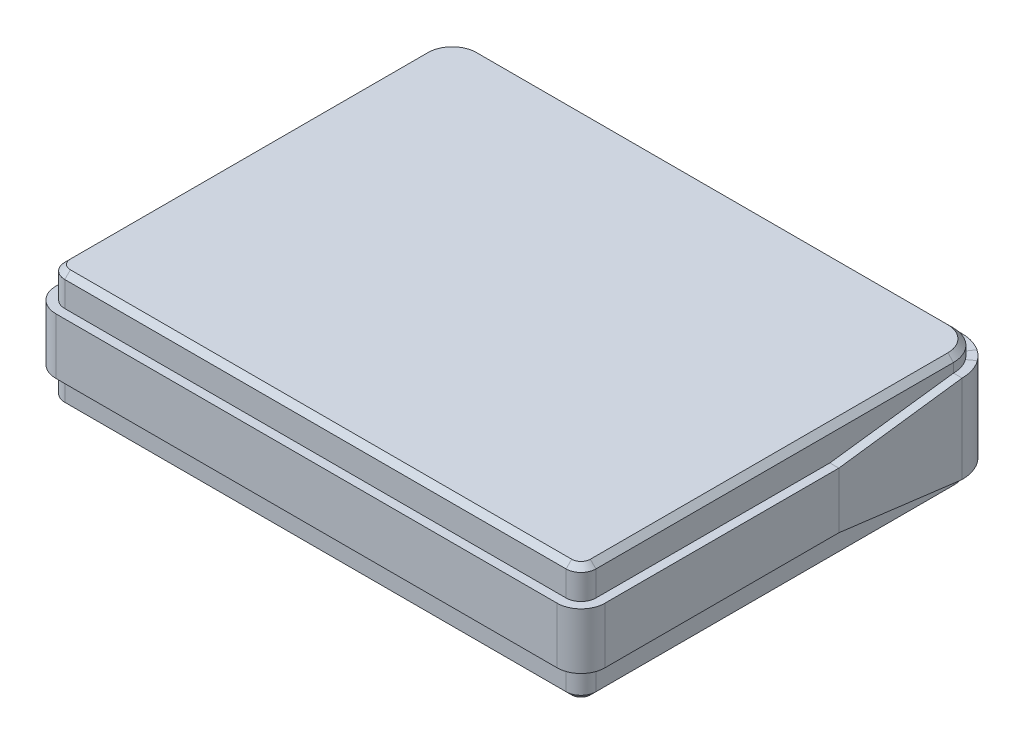
from build123d import *

# Parameters (mm, degrees)
SKETCH2_W           = 142.3
SKETCH2_H           = 107.8
BOSS_EXTRUDE1_DEPTH = 31.5
FILLET1_R           = 4
FILLET2_R           = 8
CHAMFER1_SIZE       = 1.5
SKETCH3_W           = 2.4
SKETCH3_H           = 15
SKETCH5_W           = 2.3
SKETCH5_H           = 23.55
SKETCH8_W           = 2.3
SKETCH8_H           = 23.55
SKETCH10_W          = 2.3
SKETCH10_H          = 3
SKETCH13_W          = 2.3
SKETCH13_H          = 3
BOSS_EXTRUDE2_DEPTH = 126.3
SKETCH16_W          = 2.3
SKETCH16_H          = 23.55
SKETCH17_W          = 135.171862784
SKETCH17_H          = 20.55
CUT_EXTRUDE1_DEPTH  = 1.342484496
CUT_EXTRUDE2_DEPTH  = 3.76
CUT_EXTRUDE3_START  = 1.5
CUT_EXTRUDE3_DEPTH  = 2.26
CUT_EXTRUDE4_START  = 1.5
CUT_EXTRUDE4_DEPTH  = 2.26
CUT_EXTRUDE5_START  = 1.5
CUT_EXTRUDE5_DEPTH  = 2.26
CUT_EXTRUDE6_START  = 1.5
CUT_EXTRUDE6_DEPTH  = 2.26
SKETCH23_R          = 3.2
CUT_EXTRUDE7_DEPTH  = 10
SKETCH24_R          = 0.875
BOSS_EXTRUDE4_DEPTH = 10
SKETCH25_R          = 1.4
CUT_EXTRUDE8_DEPTH  = 4
SKETCH26_W          = 8.4
SKETCH26_H          = 4.5
CUT_EXTRUDE9_DEPTH  = 4
CUT_EXTRUDE10_DEPTH = 10


# Read off the part's stored shape, not the designer's step: Cut-Extrude3, Cut-Extrude4, Cut-Extrude5, Cut-Extrude6
with BuildPart() as part:
    # Sketch2 → Boss-Extrude1 (new body)
    with BuildSketch(Plane(origin=(0, 0, 0), x_dir=(1, 0, 0), z_dir=(0, 1, 0))):
        Rectangle(SKETCH2_W, SKETCH2_H)
    extrude(amount=BOSS_EXTRUDE1_DEPTH)

    # Fillet1
    fillet1_edges = [part.edges().sort_by_distance(p)[0] for p in [
        (71.15, 15.75, 53.9),
        (-71.15, 15.75, 53.9),
    ]]
    fillet(fillet1_edges, radius=FILLET1_R)

    # Fillet2
    fillet2_edges = [part.edges().sort_by_distance(p)[0] for p in [
        (-71.15, 15.75, -53.9),
        (71.15, 15.75, -53.9),
    ]]
    fillet(fillet2_edges, radius=FILLET2_R)

    # Chamfer1
    chamfer1_edges = [part.edges().sort_by_distance(p)[0] for p in [
        (71.15, 0, 2),
        (71.15, 31.5, 2),
        (0, 0, 53.9),
        (-69.978427125, 0, 52.728427125),
        (69.978427125, 0, 52.728427125),
        (0, 31.5, 53.9),
        (-69.978427125, 31.5, 52.728427125),
        (69.978427125, 31.5, 52.728427125),
        (-71.15, 0, 2),
        (-71.15, 31.5, 2),
        (0, 0, -53.9),
        (68.806854249, 0, -51.556854249),
        (-68.806854249, 0, -51.556854249),
        (0, 31.5, -53.9),
        (68.806854249, 31.5, -51.556854249),
        (-68.806854249, 31.5, -51.556854249),
    ]]
    chamfer(chamfer1_edges, length=CHAMFER1_SIZE)

    # Sweep1: sweep along a path in Sketch4
    with BuildLine(Plane(origin=(0, 31.5, 0), x_dir=(1, 0, 0), z_dir=(0, 1, 0))) as sweep1_path:
        Line((-71.15, 12.77), (-71.15, -49.9))
        ThreePointArc((-71.15, -49.9), (-69.978427125, -52.728427125), (-67.15, -53.9))
        Line((-67.15, -53.9), (67.15, -53.9))
        ThreePointArc((67.15, -53.9), (69.978427125, -52.728427125), (71.15, -49.9))
        Line((71.15, -49.9), (71.15, 12.77))
    # Sketch3 → Sweep1 (sweep)
    with BuildSketch(Plane.XY.offset(-12.77)):
        with Locations((-72.35, 15.75)):
            Rectangle(SKETCH3_W, SKETCH3_H)
    sweep(path=sweep1_path.line)

    # Sweep2: sweep along a path in Sketch7
    with BuildLine(Plane(origin=(0, 31.5, 0), x_dir=(1, 0, 0), z_dir=(0, 1, 0))) as sweep2_path:
        ThreePointArc((-69.595416402, 50.638840302), (-70.751425235, 48.393658836), (-71.15, 45.9))
    # Sketch5 → Sweep2 (sweep)
    with BuildSketch(Plane(origin=(-0.252724738, 0, 0.3437373), x_dir=(0.8056770502487833, 0, 0.5923550377116917), z_dir=(-0.5923550377116917, 0, 0.8056770502487833))):
        with Locations((-87.217601954, 15.75)):
            Rectangle(SKETCH5_W, SKETCH5_H)
    sweep2 = sweep(path=sweep2_path.line)

    # loft from a face of the part (loft1)
    loft([part.faces().sort_by_distance((-72.3, 15.75, -45.9))[0], part.faces().sort_by_distance((-72.35, 15.75, -12.77))[0]])



with BuildPart() as body_2:
    # Sweep3: sweep along a path in Sketch9
    with BuildLine(Plane(origin=(0, 31.5, 0), x_dir=(1, 0, 0), z_dir=(0, 1, 0))) as sweep3_path:
        ThreePointArc((-67.585931392, 52.557515504), (-68.674605061, 51.686081482), (-69.595416402, 50.638840302))
    # Sketch8 → Sweep3 (sweep)
    with BuildSketch(Plane(origin=(-22.553670809, 0, 15.027608464), x_dir=(-0.5544914239575055, 0, -0.8321894380233252), z_dir=(0.8321894380233252, 0, -0.5544914239575055))):
        with Locations((82.363628628, 15.75)):
            Rectangle(SKETCH8_W, SKETCH8_H)
    sweep(path=sweep3_path.line)


with BuildPart() as part_1:
    add(part.part)

    add(body_2.part)  # Sweep4 merges body 2
    # Sweep4: sweep along a path in Sketch12
    with BuildLine(Plane(origin=(0, 31.5, 0), x_dir=(1, 0, 0), z_dir=(0, 1, 0))) as sweep4_path:
        ThreePointArc((-67.585931392, 52.557515504), (-65.467312664, 53.55702697), (-63.15, 53.9))
    # Sketch10 → Sweep4 (sweep)
    with BuildSketch(Plane(origin=(-22.553670809, 0, 15.027608464), x_dir=(-0.5544914239575068, 0, -0.8321894380233245), z_dir=(0.8321894380233245, 0, -0.5544914239575068))):
        with Locations((82.363628628, 26.025)):
            Rectangle(SKETCH10_W, SKETCH10_H)
    sweep4 = sweep(path=sweep4_path.line)

    # Sketch13 → Boss-Extrude2 (add)
    with BuildSketch(Plane(origin=(-63.15, 0, 0), x_dir=(0, 0, -1), z_dir=(1, 0, 0))):
        with Locations((55.05, 26.025)):
            Rectangle(SKETCH13_W, SKETCH13_H)
    extrude(amount=BOSS_EXTRUDE2_DEPTH)

    # Mirror3: Sweep2, Sweep4 across plane
    add(sweep2.mirror(Plane(origin=(0, 0, 0), x_dir=(0, 0, 1), z_dir=(1, 0, 0))))
    add(sweep4.mirror(Plane(origin=(0, 0, 0), x_dir=(0, 0, 1), z_dir=(1, 0, 0))))

    # loft from a face of the part (loft2)
    loft([part_1.faces().sort_by_distance((72.35, 15.75, -12.77))[0], part_1.faces().sort_by_distance((72.3, 15.75, -45.9))[0]])

    # Sketch17 → Cut-Extrude1 (cut)
    with BuildSketch(Plane(origin=(0, 0, -53.9), x_dir=(-1, 0, 0), z_dir=(0, 0, -1))):
        with Locations((0, 14.25)):
            Rectangle(SKETCH17_W, SKETCH17_H)
    extrude(amount=-CUT_EXTRUDE1_DEPTH, mode=Mode.SUBTRACT)

    # Sketch18 → Cut-Extrude2 (cut)
    with BuildSketch(Plane.XZ):
        with BuildLine():
            Line((50.878643943, -6.287184335), (53.274618026, -3.891210252))
            ThreePointArc((53.274618026, -3.891210252), (56.39761237, -2.79761237), (57.491210252, 0.325381974))
            Line((57.491210252, 0.325381974), (59.887184335, 2.721356057))
            ThreePointArc((59.887184335, 2.721356057), (59.887184335, 6.087184335), (56.521356057, 6.087184335))
            Line((56.521356057, 6.087184335), (54.125381974, 3.691210252))
            ThreePointArc((54.125381974, 3.691210252), (51.00238763, 2.59761237), (49.908789748, -0.525381974))
            Line((49.908789748, -0.525381974), (47.512815665, -2.921356057))
            ThreePointArc((47.512815665, -2.921356057), (47.512815665, -6.287184335), (50.878643943, -6.287184335))
        make_face()
        with BuildLine():
            Line((-56.341210252, -0.525381974), (-58.737184335, -2.921356057))
            ThreePointArc((-58.737184335, -2.921356057), (-58.737184335, -6.287184335), (-55.371356057, -6.287184335))
            Line((-55.371356057, -6.287184335), (-52.975381974, -3.891210252))
            ThreePointArc((-52.975381974, -3.891210252), (-49.85238763, -2.79761237), (-48.758789748, 0.325381974))
            Line((-48.758789748, 0.325381974), (-46.362815665, 2.721356057))
            ThreePointArc((-46.362815665, 2.721356057), (-46.362815665, 6.087184335), (-49.728643943, 6.087184335))
            Line((-49.728643943, 6.087184335), (-52.124618026, 3.691210252))
            ThreePointArc((-52.124618026, 3.691210252), (-55.24761237, 2.59761237), (-56.341210252, -0.525381974))
        make_face()
    extrude(amount=-CUT_EXTRUDE2_DEPTH, mode=Mode.SUBTRACT)

    # Cut-Extrude3 outline → Cut-Extrude3 (cut)
    with BuildSketch(Plane(origin=(0, 0, 0), x_dir=(1, 0, 0), z_dir=(0, 1, 0)).offset(CUT_EXTRUDE3_START)):
        with BuildLine():
            Line((-54.446182004, -3.210395566), (-48.97119634, -8.685381231))
            ThreePointArc((-48.97119634, -8.685381231), (-44.948602102, -7.501397898), (-43.764618769, -3.47880366))
            Line((-43.764618769, -3.47880366), (-49.239604434, 1.996182004))
            ThreePointArc((-49.239604434, 1.996182004), (-48.814278366, 0.873698179), (-48.758789748, -0.325381974))
            Line((-48.758789748, -0.325381974), (-46.362815665, -2.721356057))
            ThreePointArc((-46.362815665, -2.721356057), (-46.362815665, -6.087184335), (-49.728643943, -6.087184335))
            Line((-49.728643943, -6.087184335), (-52.124618026, -3.691210252))
            ThreePointArc((-52.124618026, -3.691210252), (-53.323698179, -3.635721634), (-54.446182004, -3.210395566))
        make_face()
    extrude(amount=CUT_EXTRUDE3_DEPTH, mode=Mode.SUBTRACT)

    # Cut-Extrude4 outline → Cut-Extrude4 (cut)
    with BuildSketch(Plane(origin=(0, 0, 0), x_dir=(1, 0, 0), z_dir=(0, 1, 0)).offset(CUT_EXTRUDE4_START)):
        with BuildLine():
            ThreePointArc((-56.12880366, 8.885381231), (-60.151397898, 7.701397898), (-61.335381231, 3.67880366))
            Line((-61.335381231, 3.67880366), (-55.860395566, -1.796182004))
            ThreePointArc((-55.860395566, -1.796182004), (-56.285721634, -0.673698179), (-56.341210252, 0.525381974))
            Line((-56.341210252, 0.525381974), (-58.737184335, 2.921356057))
            ThreePointArc((-58.737184335, 2.921356057), (-58.737184335, 6.287184335), (-55.371356057, 6.287184335))
            Line((-55.371356057, 6.287184335), (-52.975381974, 3.891210252))
            ThreePointArc((-52.975381974, 3.891210252), (-51.776301821, 3.835721634), (-50.653817996, 3.410395566))
            Line((-50.653817996, 3.410395566), (-56.12880366, 8.885381231))
        make_face()
    extrude(amount=CUT_EXTRUDE4_DEPTH, mode=Mode.SUBTRACT)

    # Cut-Extrude5 outline → Cut-Extrude5 (cut)
    with BuildSketch(Plane(origin=(0, 0, 0), x_dir=(1, 0, 0), z_dir=(0, 1, 0)).offset(CUT_EXTRUDE5_START)):
        with BuildLine():
            Line((51.803817996, -3.210395566), (57.27880366, -8.685381231))
            ThreePointArc((57.27880366, -8.685381231), (61.301397898, -7.501397898), (62.485381231, -3.47880366))
            Line((62.485381231, -3.47880366), (57.010395566, 1.996182004))
            ThreePointArc((57.010395566, 1.996182004), (57.435721634, 0.873698179), (57.491210252, -0.325381974))
            Line((57.491210252, -0.325381974), (59.887184335, -2.721356057))
            ThreePointArc((59.887184335, -2.721356057), (59.887184335, -6.087184335), (56.521356057, -6.087184335))
            Line((56.521356057, -6.087184335), (54.125381974, -3.691210252))
            ThreePointArc((54.125381974, -3.691210252), (52.926301821, -3.635721634), (51.803817996, -3.210395566))
        make_face()
    extrude(amount=CUT_EXTRUDE5_DEPTH, mode=Mode.SUBTRACT)

    # Cut-Extrude6 outline → Cut-Extrude6 (cut)
    with BuildSketch(Plane(origin=(0, 0, 0), x_dir=(1, 0, 0), z_dir=(0, 1, 0)).offset(CUT_EXTRUDE6_START)):
        with BuildLine():
            ThreePointArc((50.12119634, 8.885381231), (46.098602102, 7.701397898), (44.914618769, 3.67880366))
            Line((44.914618769, 3.67880366), (50.389604434, -1.796182004))
            ThreePointArc((50.389604434, -1.796182004), (49.964278366, -0.673698179), (49.908789748, 0.525381974))
            Line((49.908789748, 0.525381974), (47.512815665, 2.921356057))
            ThreePointArc((47.512815665, 2.921356057), (47.512815665, 6.287184335), (50.878643943, 6.287184335))
            Line((50.878643943, 6.287184335), (53.274618026, 3.891210252))
            ThreePointArc((53.274618026, 3.891210252), (54.473698179, 3.835721634), (55.596182004, 3.410395566))
            Line((55.596182004, 3.410395566), (50.12119634, 8.885381231))
        make_face()
    extrude(amount=CUT_EXTRUDE6_DEPTH, mode=Mode.SUBTRACT)

    # Sketch23 → Cut-Extrude7 (cut)
    with BuildSketch(Plane(origin=(0, 0, -52.557515504), x_dir=(-1, 0, 0), z_dir=(0, 0, -1))):
        with Locations((45.785931392, 15.975)):
            Circle(SKETCH23_R)
    extrude(amount=-CUT_EXTRUDE7_DEPTH, mode=Mode.SUBTRACT)

    # Sketch24 → Boss-Extrude4 (add)
    with BuildSketch(Plane(origin=(0, 0, -42.557515504), x_dir=(-1, 0, 0), z_dir=(0, 0, -1))):
        with Locations((45.785931392, 15.975)):
            Circle(SKETCH24_R)
    extrude(amount=BOSS_EXTRUDE4_DEPTH)

    # Sketch25 → Cut-Extrude8 (cut)
    with BuildSketch(Plane(origin=(0, 0, -52.557515504), x_dir=(-1, 0, 0), z_dir=(0, 0, -1))):
        with Locations((34.385931392, 13.375)):
            Circle(SKETCH25_R)
    extrude(amount=-CUT_EXTRUDE8_DEPTH, mode=Mode.SUBTRACT)

    # Sketch26 → Cut-Extrude9 (cut)
    with BuildSketch(Plane(origin=(0, 0, -52.557515504), x_dir=(-1, 0, 0), z_dir=(0, 0, -1))):
        with Locations((20.635931392, 12.675)):
            Rectangle(SKETCH26_W, SKETCH26_H)
    extrude(amount=-CUT_EXTRUDE9_DEPTH, mode=Mode.SUBTRACT)

    # Sketch27 → Cut-Extrude10 (cut)
    with BuildSketch(Plane(origin=(0, 0, -52.557515504), x_dir=(-1, 0, 0), z_dir=(0, 0, -1))):
        Polygon((-42.510931392, 13.645), (-39.685931392, 13.645), (-39.685931392, 20.525), (-51.585931392, 20.525), (-51.585931392, 13.645), (-48.760931392, 13.645), (-48.760931392, 12.645), (-47.785931392, 12.645), (-47.785931392, 10.945), (-43.485931392, 10.945), (-43.485931392, 12.645), (-42.510931392, 12.645), align=None)
        Polygon((-37.235931392, 20.525), (-25.335931392, 20.525), (-25.335931392, 13.645), (-28.160931392, 13.645), (-28.160931392, 12.645), (-29.135931392, 12.645), (-29.135931392, 10.945), (-33.435931392, 10.945), (-33.435931392, 12.645), (-34.410931392, 12.645), (-34.410931392, 13.645), (-37.235931392, 13.645), align=None)
        Polygon((-22.885931392, 20.525), (-10.985931392, 20.525), (-10.985931392, 13.645), (-13.810931392, 13.645), (-13.810931392, 12.645), (-14.785931392, 12.645), (-14.785931392, 10.945), (-19.085931392, 10.945), (-19.085931392, 12.645), (-20.060931392, 12.645), (-20.060931392, 13.645), (-22.885931392, 13.645), align=None)
        Polygon((-8.535931392, 20.525), (3.364068608, 20.525), (3.364068608, 13.645), (0.539068608, 13.645), (0.539068608, 12.645), (-0.435931392, 12.645), (-0.435931392, 10.945), (-4.735931392, 10.945), (-4.735931392, 12.645), (-5.710931392, 12.645), (-5.710931392, 13.645), (-8.535931392, 13.645), align=None)
    extrude(amount=-CUT_EXTRUDE10_DEPTH, mode=Mode.SUBTRACT)


with BuildPart() as body_2_2:
    # Sweep5: sweep along a path in Sketch15
    with BuildLine(Plane(origin=(0, 31.5, 0), x_dir=(1, 0, 0), z_dir=(0, 1, 0))) as sweep5_path:
        ThreePointArc((67.585931392, 52.557515504), (68.674605061, 51.686081482), (69.595416402, 50.638840302))
    # Sketch16 → Sweep5 (sweep)
    with BuildSketch(Plane(origin=(0.252724738, 0, 0.3437373), x_dir=(-0.8056770502487846, 0, 0.59235503771169), z_dir=(-0.59235503771169, 0, -0.8056770502487846))):
        with Locations((-87.217601954, 15.75)):
            Rectangle(SKETCH16_W, SKETCH16_H)
    sweep(path=sweep5_path.line)


solid = Compound([part_1.part, body_2_2.part])
